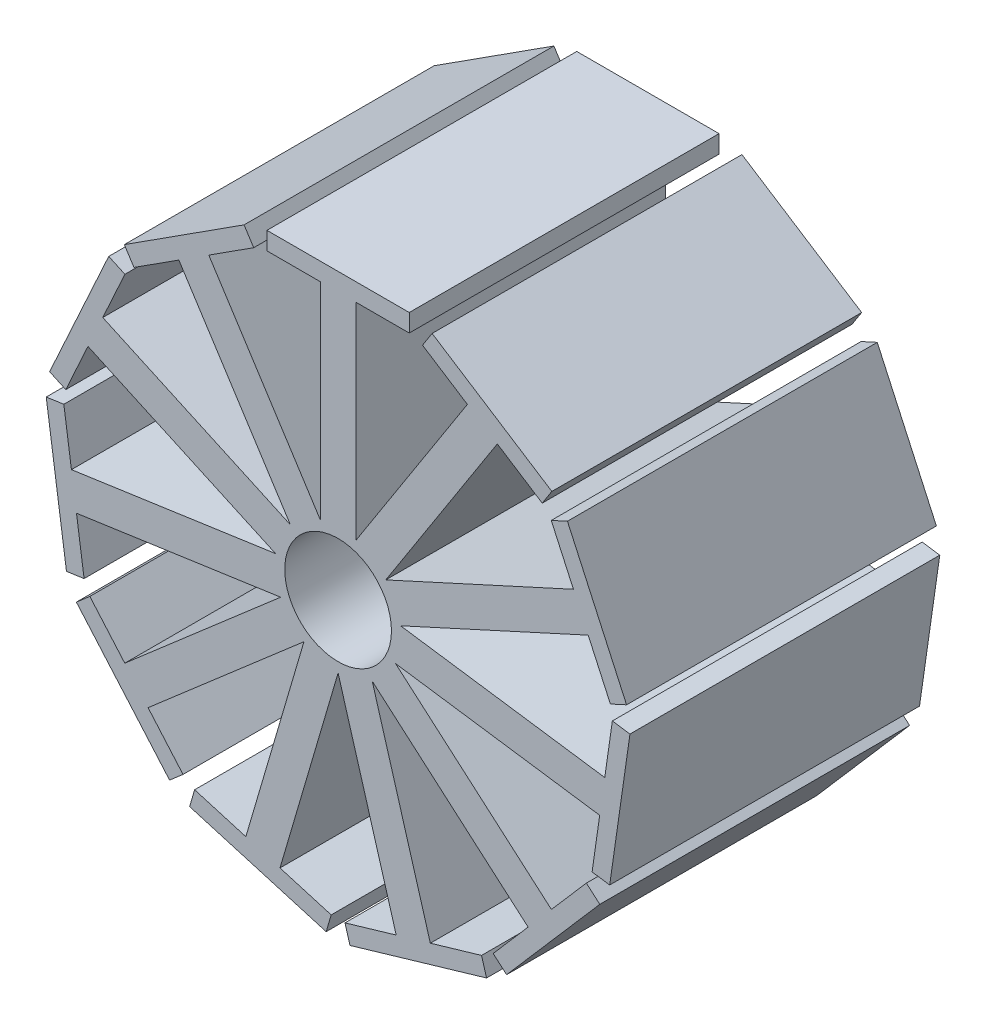
from build123d import *

# Parameters (mm, degrees)
STOK_DYS_START             = 4.792312704
STOK_DYS_BE1806_13_1_DEPTH = 8.707687296
IZIM1_R                    = 1.5
KES_EKSTR_ZYON1_DEPTH      = 10


# Read off the part's stored shape, not the designer's step: Stok-DYS BE1806-13-1
with BuildPart() as part:
    # Stok-DYS BE1806-13-1 outline → Stok-DYS BE1806-13-1 (new body)
    with BuildSketch(Plane.XY.offset(STOK_DYS_START)):
        Polygon((2, 7.5), (2, 8), (-2, 8), (-2, 7.5), (-0.5, 7.5), (-0.5, 1.702843619), (-3.634179365, 6.579721905), (-2.372299065, 7.390683131), (-2.642619474, 7.811309898), (-6.007633605, 5.648746628), (-5.737313197, 5.228119861), (-4.475432897, 6.039081088), (-1.341253533, 1.162202802), (-6.614532459, 3.570428595), (-5.991409939, 4.934876588), (-6.446225937, 5.142584095), (-8.107885989, 1.504056113), (-7.653069991, 1.296348607), (-7.029947472, 2.6607966), (-1.756668546, 0.252570807), (-7.494818233, -0.572450566), (-7.708290491, 0.912281597), (-8.203201212, 0.841124178), (-7.633941859, -3.11816159), (-7.139031138, -3.047004171), (-7.352503395, -1.562272008), (-1.614353708, -0.737250635), (-5.995552175, -4.533580717), (-6.977843276, -3.399956356), (-7.355718063, -3.727386723), (-4.736275127, -6.75038502), (-4.35840034, -6.422954653), (-5.340691441, -5.289330292), (-0.959492974, -1.49300021), (-2.592740663, -7.055331024), (-4.031980124, -6.632732188), (-4.172846402, -7.112478675), (-0.334874508, -8.239408903), (-0.194008229, -7.759662416), (-1.63324769, -7.337063581), (0, -1.774732766), (1.63324769, -7.337063581), (0.194008229, -7.759662416), (0.334874508, -8.239408903), (4.172846402, -7.112478675), (4.031980124, -6.632732188), (2.592740663, -7.055331024), (0.959492974, -1.49300021), (5.340691441, -5.289330292), (4.35840034, -6.422954653), (4.736275127, -6.75038502), (7.355718063, -3.727386723), (6.977843276, -3.399956356), (5.995552175, -4.533580717), (1.614353708, -0.737250635), (7.352503395, -1.562272008), (7.139031138, -3.047004171), (7.633941859, -3.11816159), (8.203201212, 0.841124178), (7.708290491, 0.912281597), (7.494818233, -0.572450566), (1.756668546, 0.252570807), (7.029947472, 2.6607966), (7.653069991, 1.296348607), (8.107885989, 1.504056113), (6.446225937, 5.142584095), (5.991409939, 4.934876588), (6.614532459, 3.570428595), (1.341253533, 1.162202802), (4.475432897, 6.039081088), (5.737313197, 5.228119861), (6.007633605, 5.648746628), (2.642619474, 7.811309898), (2.372299065, 7.390683131), (3.634179364, 6.579721905), (0.5, 1.702843619), (0.5, 7.5), align=None)
    extrude(amount=STOK_DYS_BE1806_13_1_DEPTH)

    # Çizim1 → Kes-Ekstrüzyon1 (cut)
    with BuildSketch(Plane.XY.offset(13.5)):
        Circle(IZIM1_R)
    extrude(amount=-KES_EKSTR_ZYON1_DEPTH, mode=Mode.SUBTRACT)


solid = part.part
